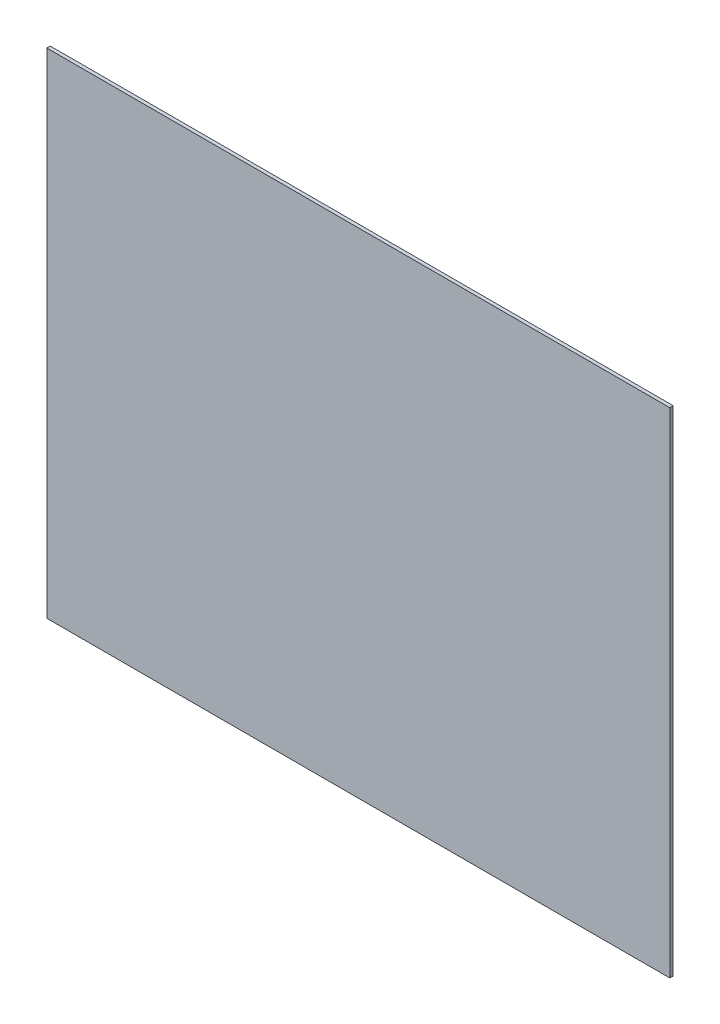
from build123d import *

# Parameters (mm, degrees)
SKETCH1_W           = 579
SKETCH1_H           = 459
BOSS_EXTRUDE1_DEPTH = 1.5875


with BuildPart() as part:
    # Sketch1 → Boss-Extrude1 (new, symmetric)
    with BuildSketch(Plane.XY):
        Rectangle(SKETCH1_W, SKETCH1_H)
    extrude(amount=BOSS_EXTRUDE1_DEPTH, both=True)


solid = part.part
